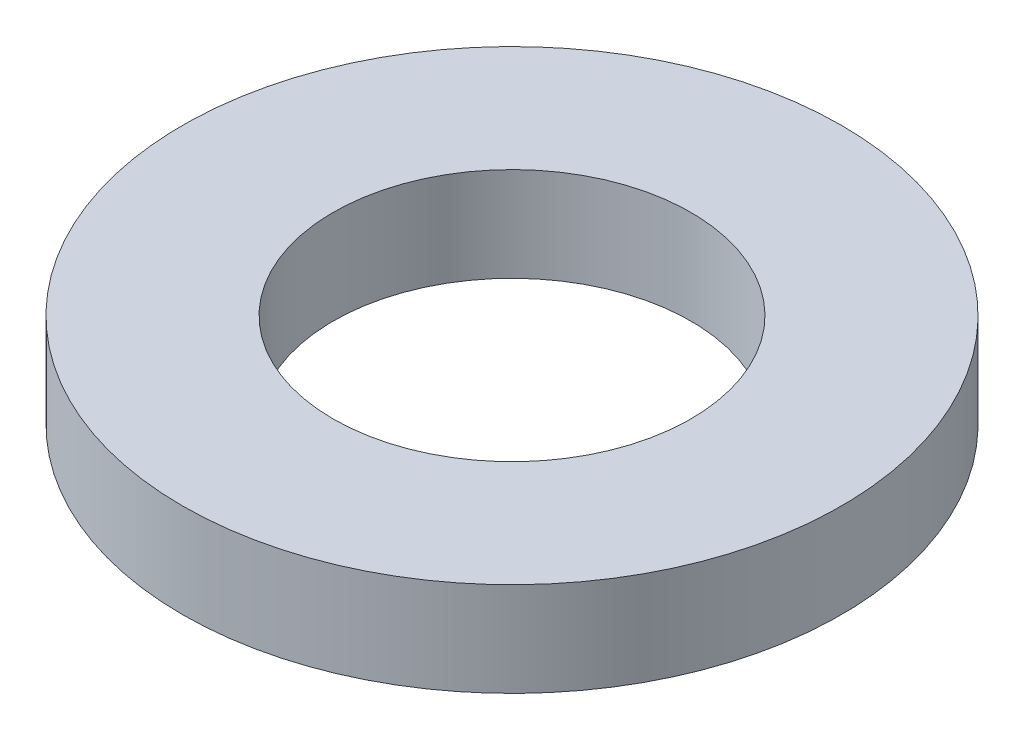
from build123d import *

# Parameters (mm, degrees)
SKETCH1_R           = 87.5
BOSS_EXTRUDE1_DEPTH = 25
SKETCH2_R           = 47.5
CUT_EXTRUDE1_DEPTH  = 127.24381173


with BuildPart() as part:
    # Sketch1 → Boss-Extrude1 (new body)
    with BuildSketch(Plane(origin=(0, 0, 0), x_dir=(1, 0, 0), z_dir=(0, 1, 0))):
        Circle(SKETCH1_R)
    extrude(amount=BOSS_EXTRUDE1_DEPTH)

    # Sketch2 → Cut-Extrude1 (cut, through all)
    with BuildSketch(Plane(origin=(0, 0, 0), x_dir=(1, 0, 0), z_dir=(0, 1, 0))):
        Circle(SKETCH2_R)
    extrude(amount=CUT_EXTRUDE1_DEPTH, mode=Mode.SUBTRACT)


solid = part.part
